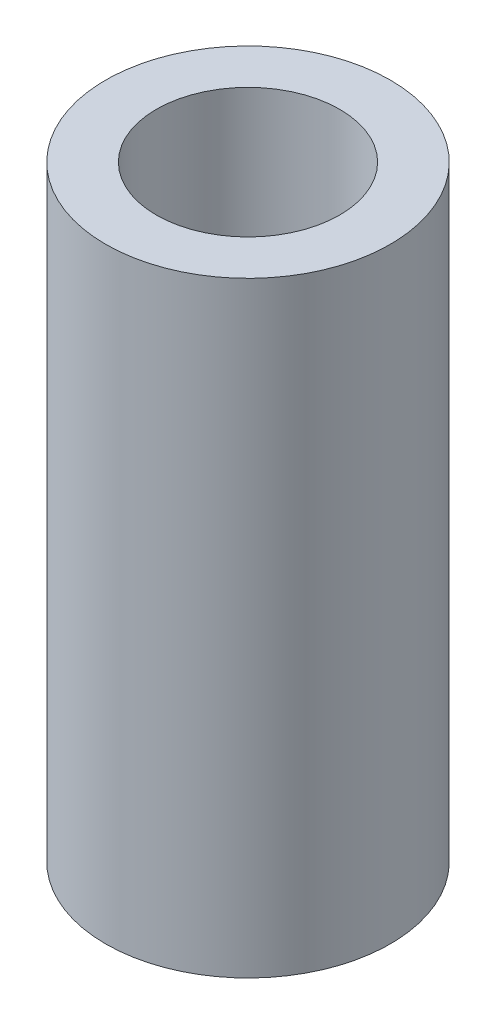
from build123d import *

# Parameters (mm, degrees)
SKETCH1_R           = 15
BOSS_EXTRUDE1_DEPTH = 63.86722587
SKETCH2_R           = 9.661822357
CUT_EXTRUDE1_DEPTH  = 68.2980129


with BuildPart() as part:
    # Sketch1 → Boss-Extrude1 (new body)
    with BuildSketch(Plane(origin=(0, 0, 0), x_dir=(1, 0, 0), z_dir=(0, 1, 0))):
        Circle(SKETCH1_R)
    extrude(amount=BOSS_EXTRUDE1_DEPTH)

    # Sketch2 → Cut-Extrude1 (cut, through all)
    with BuildSketch(Plane(origin=(0, 0, 0), x_dir=(1, 0, 0), z_dir=(0, 1, 0))):
        Circle(SKETCH2_R)
    extrude(amount=CUT_EXTRUDE1_DEPTH, mode=Mode.SUBTRACT)


solid = part.part
